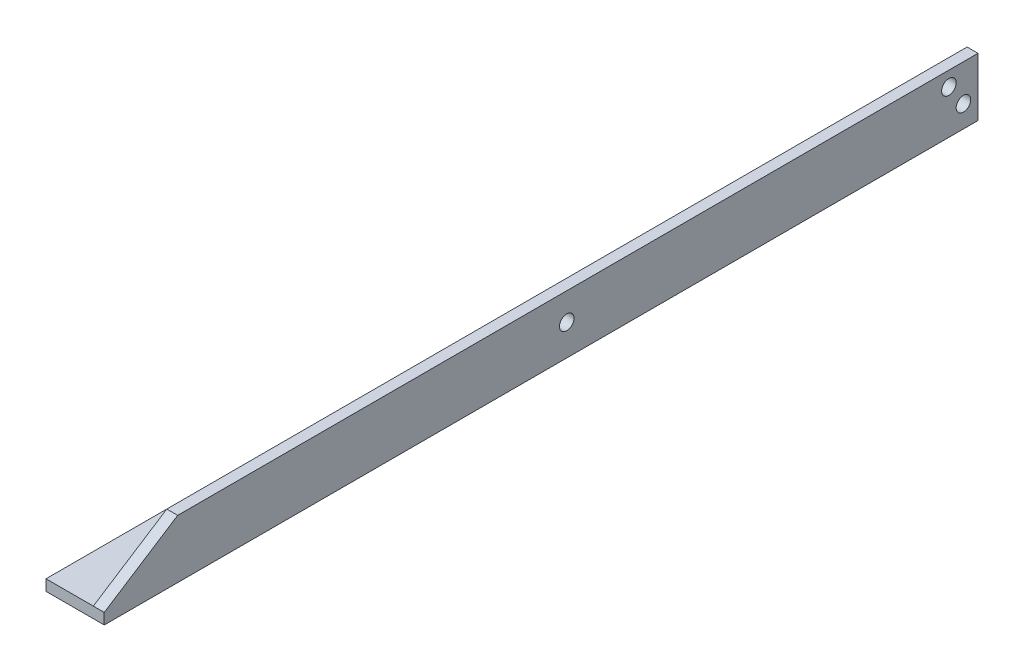
from build123d import *

# Parameters (mm, degrees)
BOSS_EXTRUDE1_DEPTH     = 381
CUT_EXTRUDE3_DEPTH      = 383.403015687
CUT_EXTRUDE3_DEPTH_BACK = 383.403015687
CUT_EXTRUDE4_REACH      = 384.403
SKETCH6_R               = 3.175
CUT_EXTRUDE5_REACH      = 384.69
SKETCH7_R               = 3.175
CUT_EXTRUDE6_REACH      = 384.403
SKETCH8_R               = 3.175


with BuildPart() as part:
    # Sketch1 → Boss-Extrude1 (new body)
    with BuildSketch(Plane.XY):
        Polygon((0, 0), (0, -25.4), (-25.4, -25.4), (-25.4, -20.6375), (-4.7625, -20.6375), (-4.7625, 0), align=None)
    extrude(amount=BOSS_EXTRUDE1_DEPTH)

    # Sketch4 → Cut-Extrude3 (cut, two sides: drawn at the far end of the back side and taken through both)
    with BuildSketch(Plane.ZY.offset(4.7625).offset(-CUT_EXTRUDE3_DEPTH_BACK)):
        Polygon((1030.877066877, -439.409233154), (381, -20.6375), (348.97339241, 0), (-300.903674467, 418.771733154), (536.63979184, 1718.525866908), (1868.420533185, 860.3449006), align=None)
    extrude(amount=CUT_EXTRUDE3_DEPTH + CUT_EXTRUDE3_DEPTH_BACK, mode=Mode.SUBTRACT)

    # Sketch6 → Cut-Extrude4 (cut, up to next)
    with BuildSketch(Plane.ZY.offset(4.7625), mode=Mode.PRIVATE) as cut_extrude4_sk1:
        with Locations((6.35, -15.875)):
            Circle(SKETCH6_R)
    cut_extrude4_tool1 = extrude(cut_extrude4_sk1.sketch, amount=-CUT_EXTRUDE4_REACH, mode=Mode.PRIVATE) & part.part
    # Sketch6 → Cut-Extrude4 (cut, up to next)
    with BuildSketch(Plane.ZY.offset(4.7625), mode=Mode.PRIVATE) as cut_extrude4_sk2:
        with Locations((12.7, -6.35)):
            Circle(SKETCH6_R)
    cut_extrude4_tool2 = extrude(cut_extrude4_sk2.sketch, amount=-CUT_EXTRUDE4_REACH, mode=Mode.PRIVATE) & part.part
    add(cut_extrude4_tool1.solids().sort_by_distance((-4.7625, -15.875, 6.35))[0], mode=Mode.SUBTRACT)
    add(cut_extrude4_tool2.solids().sort_by_distance((-4.7625, -6.35, 12.7))[0], mode=Mode.SUBTRACT)

    # Sketch7 → Cut-Extrude5 (cut, up to next)
    with BuildSketch(Plane(origin=(0, 0, 0), x_dir=(0, 0, -1), z_dir=(1, 0, 0)), mode=Mode.PRIVATE) as cut_extrude5_sk1:
        with Locations((-179.332750482, -11.929615818)):
            Circle(SKETCH7_R)
    cut_extrude5_tool1 = extrude(cut_extrude5_sk1.sketch, amount=-CUT_EXTRUDE5_REACH, mode=Mode.PRIVATE) & part.part
    add(cut_extrude5_tool1.solids().sort_by_distance((0, -11.929616, 179.33275))[0], mode=Mode.SUBTRACT)

    # Sketch8 → Cut-Extrude6 (cut, up to next)
    with BuildSketch(Plane(origin=(0, -20.6375, 0), x_dir=(1, 0, 0), z_dir=(0, 1, 0)), mode=Mode.PRIVATE) as cut_extrude6_sk1:
        with Locations((-15.08125, -12.7)):
            Circle(SKETCH8_R)
    cut_extrude6_tool1 = extrude(cut_extrude6_sk1.sketch, amount=-CUT_EXTRUDE6_REACH, mode=Mode.PRIVATE) & part.part
    add(cut_extrude6_tool1.solids().sort_by_distance((-15.08125, -20.6375, 12.7))[0], mode=Mode.SUBTRACT)


solid = part.part
